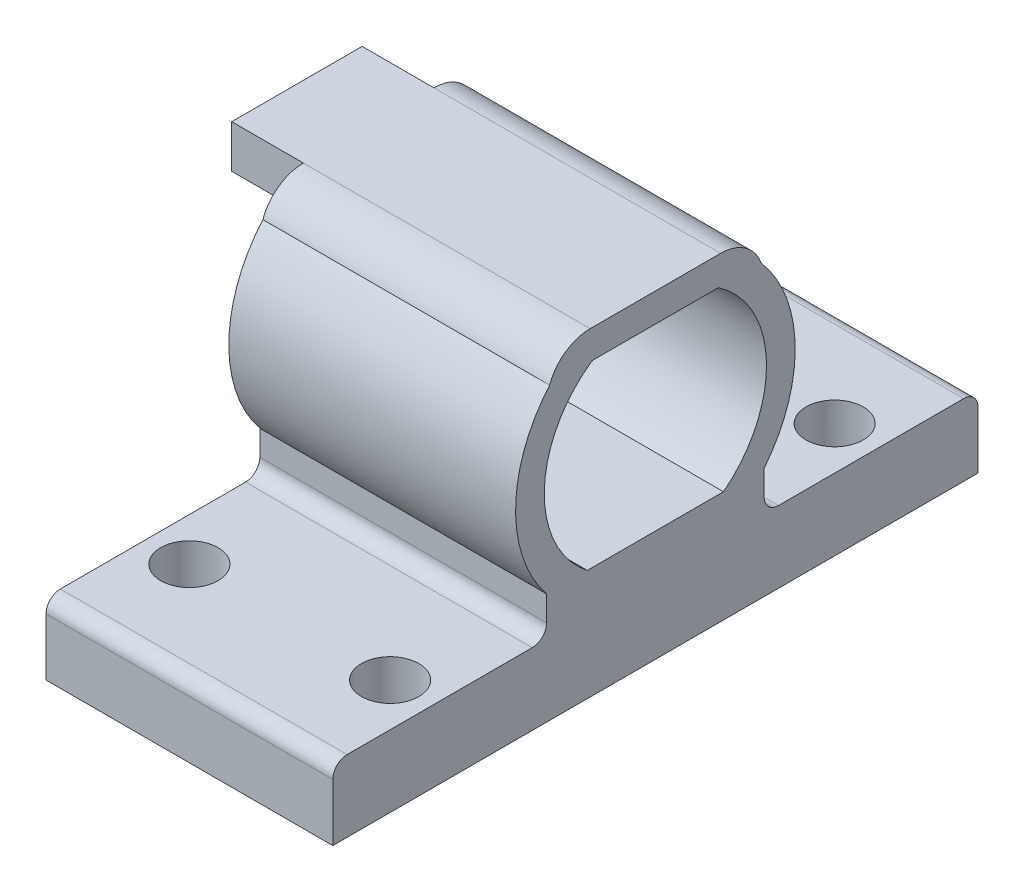
from build123d import *

# Parameters (mm, degrees)
SKETCH1_W           = 20
SKETCH1_H           = 4.75
BOSS_EXTRUDE1_DEPTH = 25
BOSS_EXTRUDE3_DEPTH = 20
SKETCH5_W           = 4.913004547
SKETCH5_H           = 2.75
CUT_EXTRUDE1_DEPTH  = 38.5807331
SKETCH9_W           = 20.464128198
SKETCH9_H           = 5.182266339
CUT_EXTRUDE3_DEPTH  = 38.5807331
SKETCH10_W          = 14.752031578
SKETCH10_H          = 2
BOSS_EXTRUDE4_DEPTH = 20
FILLET1_R           = 3
FILLET2_R           = 3
SKETCH11_W          = 20
SKETCH11_H          = 2
BOSS_EXTRUDE5_DEPTH = 10
SKETCH12_W          = 20
SKETCH12_H          = 2
BOSS_EXTRUDE6_DEPTH = 10
FILLET5_R           = 1
FILLET6_R           = 1
SKETCH13_R          = 2
CUT_EXTRUDE4_DEPTH  = 42.776882393
FILLET7_R           = 1
FILLET8_R           = 1
SKETCH14_W          = 7
SKETCH14_H          = 2
BOSS_EXTRUDE7_DEPTH = 5
SKETCH15_W          = 5
SKETCH15_H          = 9.09517733
BOSS_EXTRUDE8_DEPTH = 3
SKETCH16_W          = 20
SKETCH16_H          = 45
SKETCH16_R          = 2
BOSS_EXTRUDE9_DEPTH = 3


with BuildPart() as part:
    # Sketch1 → Boss-Extrude1 (new body)
    with BuildSketch(Plane.XY):
        with Locations((4.924657534, 1.431506849)):
            Rectangle(SKETCH1_W, SKETCH1_H)
    extrude(amount=BOSS_EXTRUDE1_DEPTH)

    # Sketch2 → Boss-Extrude3 (add)
    with BuildSketch(Plane(origin=(14.924657534, 0, 0), x_dir=(0, 0, -1), z_dir=(1, 0, 0))):
        with BuildLine():
            Line((-7.75, 3.806506849), (-4.913004547, 3.806506849))
            ThreePointArc((-4.913004547, 3.806506849), (-12.5, 19.680231206), (-20.086995453, 3.806506849))
            Line((-20.086995453, 3.806506849), (-17.25, 3.806506849))
            ThreePointArc((-17.25, 3.806506849), (-12.5, 17.680231206), (-7.75, 3.806506849))
        make_face()
    extrude(amount=-BOSS_EXTRUDE3_DEPTH)

    # Sketch5 → Cut-Extrude1 (cut, through all)
    with BuildSketch(Plane(origin=(14.924657534, 0, 0), x_dir=(0, 0, -1), z_dir=(1, 0, 0))):
        with Locations((-22.543497727, 2.431506849)):
            Rectangle(SKETCH5_W, SKETCH5_H)
        with Locations((-2.456502273, 2.431506849)):
            Rectangle(SKETCH5_W, SKETCH5_H)
    extrude(amount=-CUT_EXTRUDE1_DEPTH, mode=Mode.SUBTRACT)

    # Sketch9 → Cut-Extrude3 (cut, through all)
    with BuildSketch(Plane(origin=(14.924657534, 0, 0), x_dir=(0, 0, -1), z_dir=(1, 0, 0))):
        with Locations((-12.097906115, 18.897640018)):
            Rectangle(SKETCH9_W, SKETCH9_H)
    extrude(amount=-CUT_EXTRUDE3_DEPTH, mode=Mode.SUBTRACT)

    # Sketch10 → Boss-Extrude4 (add)
    with BuildSketch(Plane(origin=(14.924657534, 0, 0), x_dir=(0, 0, -1), z_dir=(1, 0, 0))):
        with Locations((-12.5, 17.306506849)):
            Rectangle(SKETCH10_W, SKETCH10_H)
    extrude(amount=-BOSS_EXTRUDE4_DEPTH)

    # Fillet1
    # the kernel refuses this fillet: 3 mm, written as the material it takes off along each edge
    with BuildSketch(Plane(origin=(21.995725346, 18.306506849, 5.123984211), x_dir=(0, -1, 0), z_dir=(-1, 0, 0))) as fillet1_piece_1:
        with BuildLine():
            CenterArc((3, 2.828427125), FILLET1_R, 180, 70.528779366)
            Line((0, 2.828427125), (-0.06, 2.828427125))
            Line((-0.06, 2.828427125), (-0.06, 0))
            Line((-0.06, 0), (0, -0.06))
            ThreePointArc((0, -0.06), (1, -0.06), (1.98, -0.056568542))
            Line((1.98, -0.056568542), (2, 0))
        make_face()
    extrude(amount=34.142135624, mode=Mode.SUBTRACT)

    # Fillet2
    # the kernel refuses this fillet: 3 mm, written as the material it takes off along each edge
    with BuildSketch(Plane(origin=(21.995725346, 18.306506849, 19.876015789), x_dir=(0, -1, 0), z_dir=(-1, 0, 0))) as fillet2_piece_1:
        with BuildLine():
            CenterArc((3, -2.828427125), FILLET2_R, 109.471220634, 70.528779366)
            Line((0, -2.828427125), (-0.06, -2.828427125))
            Line((-0.06, -2.828427125), (-0.06, 0))
            Line((-0.06, 0), (0, 0.06))
            ThreePointArc((0, 0.06), (1, 0.06), (1.98, 0.056568542))
            Line((1.98, 0.056568542), (2, 0))
        make_face()
    extrude(amount=34.142135624, mode=Mode.SUBTRACT)

    # Sketch11 → Boss-Extrude5 (add)
    with BuildSketch(Plane(origin=(0, 0, 0), x_dir=(-1, 0, 0), z_dir=(0, 0, -1))):
        with Locations((-4.924657534, 0.056506849)):
            Rectangle(SKETCH11_W, SKETCH11_H)
    extrude(amount=BOSS_EXTRUDE5_DEPTH)

    # Sketch12 → Boss-Extrude6 (add)
    with BuildSketch(Plane.XY.offset(25)):
        with Locations((4.924657534, 0.056506849)):
            Rectangle(SKETCH12_W, SKETCH12_H)
    extrude(amount=BOSS_EXTRUDE6_DEPTH)

    # Fillet5
    fillet5_edges = [part.edges().sort_by_distance(p)[0] for p in [
        (4.924657534, 1.056506849, 35),
    ]]
    fillet(fillet5_edges, radius=FILLET5_R)

    # Fillet6
    fillet6_edges = [part.edges().sort_by_distance(p)[0] for p in [
        (4.924657534, 1.056506849, -10),
    ]]
    fillet(fillet6_edges, radius=FILLET6_R)

    # Sketch13 → Cut-Extrude4 (cut, through all)
    with BuildSketch(Plane(origin=(0, 1.056506849, 0), x_dir=(1, 0, 0), z_dir=(0, 1, 0))):
        with Locations(Location((-2.075342466, -28, 0), (0, 0, 270))):
            Circle(SKETCH13_R)
        with Locations(Location((11.924657534, -28, 0), (0, 0, 270))):
            Circle(SKETCH13_R)
        with Locations(Location((11.924657534, 3, 0), (0, 0, 270))):
            Circle(SKETCH13_R)
        with Locations(Location((-2.075342466, 3, 0), (0, 0, 270))):
            Circle(SKETCH13_R)
    extrude(amount=-CUT_EXTRUDE4_DEPTH, mode=Mode.SUBTRACT)

    # Fillet7
    fillet7_edges = [part.edges().sort_by_distance(p)[0] for p in [
        (4.924657534, 1.056506849, 20.086995453),
    ]]
    fillet(fillet7_edges, radius=FILLET7_R)

    # Fillet8
    fillet8_edges = [part.edges().sort_by_distance(p)[0] for p in [
        (4.924657534, 1.056506849, 4.913004547),
    ]]
    fillet(fillet8_edges, radius=FILLET8_R)



with BuildPart() as body_2:
    # Sketch14 → Boss-Extrude7 (new body)
    with BuildSketch(Plane.ZY.offset(5.075342466)):
        with Locations((12.767411335, 17.306506849)):
            Rectangle(SKETCH14_W, SKETCH14_H)
    extrude(amount=BOSS_EXTRUDE7_DEPTH)


with BuildPart() as part_1:
    add(part.part)

    add(body_2.part)  # Boss-Extrude8 merges body 2
    # Sketch15 → Boss-Extrude8 (add)
    with BuildSketch(Plane.XZ.offset(-18.306506849)):
        with Locations((-7.575342466, 12.5)):
            Rectangle(SKETCH15_W, SKETCH15_H)
    extrude(amount=BOSS_EXTRUDE8_DEPTH)

    # Sketch16 → Boss-Extrude9 (add)
    with BuildSketch(Plane.XZ.offset(0.943493151)):
        with Locations((4.924657534, 12.5)):
            Rectangle(SKETCH16_W, SKETCH16_H)
        with Locations(Location((11.924657534, -3, 0), (0, 0, 90))):
            Circle(SKETCH16_R, mode=Mode.SUBTRACT)
        with Locations(Location((11.924657534, 28, 0), (0, 0, 90))):
            Circle(SKETCH16_R, mode=Mode.SUBTRACT)
        with Locations(Location((-2.075342466, 28, 0), (0, 0, 90))):
            Circle(SKETCH16_R, mode=Mode.SUBTRACT)
        with Locations(Location((-2.075342466, -3, 0), (0, 0, 90))):
            Circle(SKETCH16_R, mode=Mode.SUBTRACT)
    extrude(amount=BOSS_EXTRUDE9_DEPTH)


solid = part_1.part
